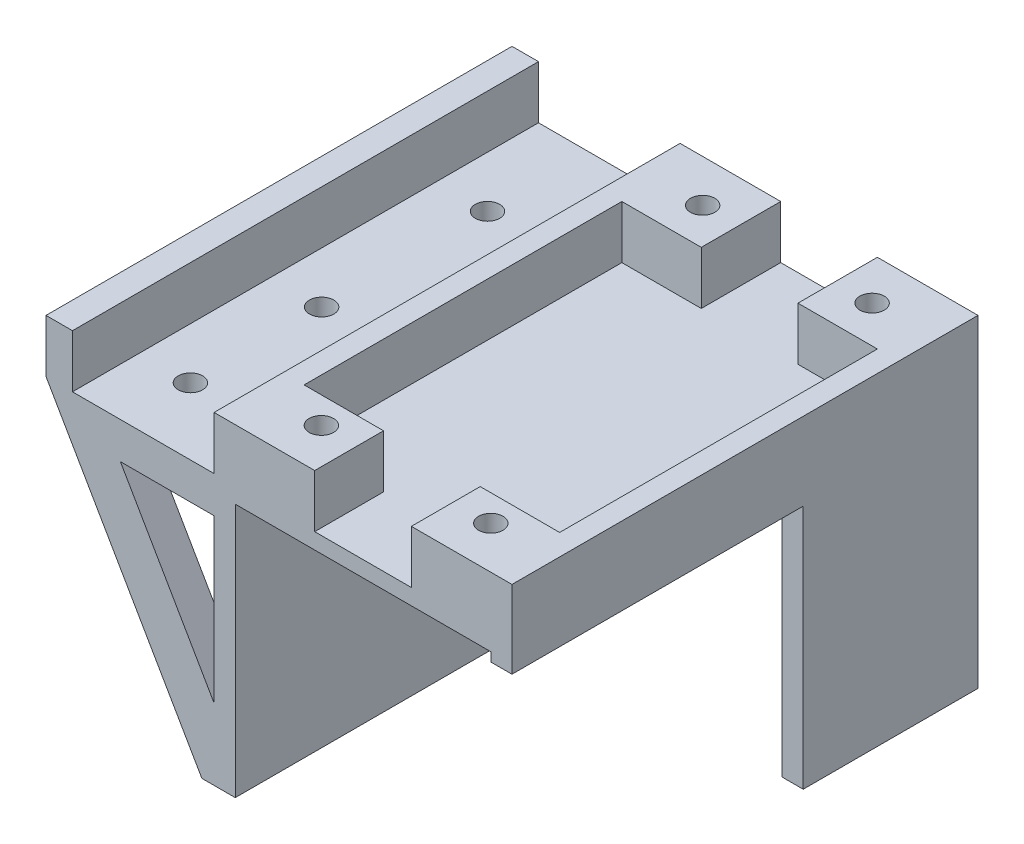
from build123d import *

# Parameters (mm, degrees)
SKETCH1_W            = 48.254
SKETCH1_H            = 10
BOSS_EXTRUDE1_DEPTH  = 70
BOSS_EXTRUDE3_DEPTH  = 8
BOSS_EXTRUDE4_DEPTH  = 8
BOSS_EXTRUDE5_DEPTH  = 8
BOSS_EXTRUDE6_DEPTH  = 70
SKETCH7_W            = 40.394634483
SKETCH7_H            = 17
CUT_EXTRUDE3_DEPTH   = 70
BOSS_EXTRUDE7_DEPTH  = 70
BOSS_EXTRUDE10_DEPTH = 8
BOSS_EXTRUDE11_DEPTH = 70
SKETCH13_W           = 83.001411072
SKETCH13_H           = 87.868559997
CUT_EXTRUDE4_DEPTH   = 4
SKETCH14_W           = 48.254
SKETCH14_H           = 10
BOSS_EXTRUDE12_DEPTH = 20
SKETCH16_W           = 56.254
SKETCH16_H           = 5
CUT_EXTRUDE5_DEPTH   = 100
SKETCH17_W           = 15
SKETCH17_H           = 15
BOSS_EXTRUDE14_DEPTH = 13
CUT_EXTRUDE8_DEPTH   = 5
SKETCH21_R           = 2.3
CUT_EXTRUDE9_DEPTH   = 15
SKETCH23_W           = 12
SKETCH23_H           = 40.530858039
CUT_EXTRUDE10_DEPTH  = 9
SKETCH25_R           = 2.3
CUT_EXTRUDE11_DEPTH  = 20
SKETCH26_R           = 2.3
CUT_EXTRUDE12_DEPTH  = 20
BOSS_EXTRUDE16_DEPTH = 20
SKETCH28_W           = 15
SKETCH28_H           = 15
BOSS_EXTRUDE17_DEPTH = 10
SKETCH29_R           = 2.3
CUT_EXTRUDE13_DEPTH  = 20
SKETCH30_W           = 10.391026801
SKETCH30_H           = 12
BOSS_EXTRUDE18_DEPTH = 5
SKETCH31_R           = 2.3
CUT_EXTRUDE14_DEPTH  = 45
SKETCH36_R           = 60.036471347
CUT_EXTRUDE15_DEPTH  = 2
SKETCH37_W           = 5
SKETCH37_H           = 88
BOSS_EXTRUDE19_DEPTH = 10
CUT_EXTRUDE16_DEPTH  = 5
SKETCH39_R           = 2.1
CUT_EXTRUDE17_DEPTH  = 5
SKETCH40_W           = 55
SKETCH40_H           = 46.30826584
CUT_EXTRUDE18_DEPTH  = 5


with BuildPart() as part:
    # Sketch1 → Boss-Extrude1 (new body)
    with BuildSketch(Plane.XY):
        Polygon((0, 70), (0, 0), (4, 0), (4, 52), (52.254, 52), (52.254, 0), (56.254, 0), (56.254, 70), align=None)
        with Locations((28.127, 60)):
            Rectangle(SKETCH1_W, SKETCH1_H, mode=Mode.SUBTRACT)
    extrude(amount=BOSS_EXTRUDE1_DEPTH)

    # Sketch3 → Boss-Extrude3 (add)
    with BuildSketch(Plane.XY.offset(70)):
        Polygon((0, 62.5), (0, 70), (-40.394634483, 70), (0, 0.034440722), (0, 17.466679003), (-26, 62.5), align=None)
    extrude(amount=-BOSS_EXTRUDE3_DEPTH)

    # Sketch4 → Boss-Extrude4 (add)
    with BuildSketch(Plane(origin=(0, 0, 0), x_dir=(-1, 0, 0), z_dir=(0, 0, -1))):
        Polygon((0, 70), (40.394634483, 70), (0, 0), (0, 17.466679003), (26, 62.5), (0, 62.5), align=None)
    extrude(amount=-BOSS_EXTRUDE4_DEPTH)

    # Sketch5 → Boss-Extrude5 (add)
    with BuildSketch(Plane(origin=(0, 0, 39), x_dir=(-1, 0, 0), z_dir=(0, 0, -1))):
        Polygon((0, 62.5), (0, 70), (40.394634483, 70), (0, 0), (0, 17.466679003), (26, 62.5), align=None)
    extrude(amount=BOSS_EXTRUDE5_DEPTH)

    # Sketch6 → Boss-Extrude6 (add)
    with BuildSketch(Plane(origin=(0, 0, 0), x_dir=(-1, 0, 0), z_dir=(0, 0, -1))):
        Polygon((0, 62.5), (36.066637932, 62.5), (40.394634483, 70), (0, 70), align=None)
        Polygon((-4, 0), (0, 0), (7.50186069, 13), (-4, 13), align=None)
    extrude(amount=-BOSS_EXTRUDE6_DEPTH)

    # Sketch7 → Cut-Extrude3 (cut)
    with BuildSketch(Plane.XY.offset(70)):
        with Locations((-20.197317242, 61.5)):
            Rectangle(SKETCH7_W, SKETCH7_H)
    extrude(amount=-CUT_EXTRUDE3_DEPTH, mode=Mode.SUBTRACT)

    # Sketch8 → Boss-Extrude7 (add)
    with BuildSketch(Plane(origin=(0, 0, 0), x_dir=(-1, 0, 0), z_dir=(0, 0, -1))):
        Polygon((-4, 55), (-4, 52), (30.007442759, 52), (31.73864138, 55), align=None)
    extrude(amount=-BOSS_EXTRUDE7_DEPTH)

    # Sketch11 → Boss-Extrude10 (add)
    with BuildSketch(Plane.XY.offset(70)):
        Polygon((-31.73864138, 55), (0, 0), (-3.053687451, 13), (-27.288965695, 55), align=None)
    extrude(amount=-BOSS_EXTRUDE10_DEPTH)

    # Sketch12 → Boss-Extrude11 (add)
    with BuildSketch(Plane.XY.offset(70)):
        Polygon((-31.73864138, 55), (-27.75981023, 48.105069917), (0, 48.105069917), (0, 55), align=None)
    extrude(amount=-BOSS_EXTRUDE11_DEPTH)

    # Sketch13 → Cut-Extrude4 (cut)
    with BuildSketch(Plane.XZ):
        with Locations((25.938658228, 33.313825886)):
            Rectangle(SKETCH13_W, SKETCH13_H)
    extrude(amount=-CUT_EXTRUDE4_DEPTH, mode=Mode.SUBTRACT)

    # Sketch14 → Boss-Extrude12 (add)
    with BuildSketch(Plane.XY.offset(70)):
        Polygon((-2.308264828, 4), (-31.73864138, 55), (0, 55), (0, 70), (56.254, 70), (56.254, 4), (52.254, 4), (52.254, 52), (4, 52), (4, 4), align=None)
        Polygon((-17.689083241, 48.105069917), (0, 48.105069917), (0, 17.466679003), align=None, mode=Mode.SUBTRACT)
        with Locations((28.127, 60)):
            Rectangle(SKETCH14_W, SKETCH14_H, mode=Mode.SUBTRACT)
    extrude(amount=BOSS_EXTRUDE12_DEPTH)

    # Sketch16 → Cut-Extrude5 (cut)
    with BuildSketch(Plane.XY.offset(90)):
        with Locations((28.127, 67.5)):
            Rectangle(SKETCH16_W, SKETCH16_H)
    extrude(amount=-CUT_EXTRUDE5_DEPTH, mode=Mode.SUBTRACT)

    # Sketch17 → Boss-Extrude14 (add)
    with BuildSketch(Plane(origin=(0, 65, 0), x_dir=(1, 0, 0), z_dir=(0, 1, 0))):
        with Locations((44.754, -7.5)):
            Rectangle(SKETCH17_W, SKETCH17_H)
        with Locations((44.754, -82.5)):
            Rectangle(SKETCH17_W, SKETCH17_H)
    extrude(amount=-BOSS_EXTRUDE14_DEPTH)

    # Sketch22 → Cut-Extrude8 (cut)
    with BuildSketch(Plane.XZ.offset(-52)):
        Polygon((48.096455918, 6.003620146), (47.904143628, 10.329474511), (44.06168771, 12.325854365), (40.411544082, 9.996379854), (40.603856372, 5.670525489), (44.44631229, 3.674145635), align=None)
        Polygon((45.200685086, 75.774625774), (48.386623963, 78.707166221), (47.439938877, 82.932540447), (43.307314914, 84.225374226), (40.121376037, 81.292833779), (41.068061123, 77.067459553), align=None)
    extrude(amount=-CUT_EXTRUDE8_DEPTH, mode=Mode.SUBTRACT)

    # Sketch21 → Cut-Extrude9 (cut)
    with BuildSketch(Plane(origin=(0, 52, 0), x_dir=(-1, 0, 0), z_dir=(0, -1, 0))):
        with Locations((-44.254, -80)):
            Circle(SKETCH21_R)
        with Locations((-44.254, -8)):
            Circle(SKETCH21_R)
    extrude(amount=-CUT_EXTRUDE9_DEPTH, mode=Mode.SUBTRACT)

    # Sketch23 → Cut-Extrude10 (cut)
    with BuildSketch(Plane(origin=(0, 0, 0), x_dir=(0, 0, 1), z_dir=(-0.8661319205837115, -0.49981546209173167, 0))):
        with Locations((76, 35.274689955)):
            Rectangle(SKETCH23_W, SKETCH23_H)
    extrude(amount=-CUT_EXTRUDE10_DEPTH, mode=Mode.SUBTRACT)

    # Sketch25 → Cut-Extrude11 (cut)
    with BuildSketch(Plane(origin=(0, 48.105069917, 0), x_dir=(-1, 0, 0), z_dir=(0, -1, 0))):
        with Locations((17.075514089, -19.30064897)):
            Circle(SKETCH25_R)
        with Locations((17.075514089, -50.613733273)):
            Circle(SKETCH25_R)
    extrude(amount=-CUT_EXTRUDE11_DEPTH, mode=Mode.SUBTRACT)

    # Sketch26 → Cut-Extrude12 (cut)
    with BuildSketch(Plane.XZ.offset(-48.105069917)):
        with Locations((-17.075514089, 75.391336138)):
            Circle(SKETCH26_R)
    extrude(amount=-CUT_EXTRUDE12_DEPTH, mode=Mode.SUBTRACT)

    # Sketch27 → Boss-Extrude16 (add)
    with BuildSketch(Plane.XY.offset(90)):
        Polygon((-23.310381194, 48.105069917), (-27.75981023, 48.105069917), (-31.73864138, 55), (-23.310381194, 55), align=None)
    extrude(amount=-BOSS_EXTRUDE16_DEPTH)

    # Sketch28 → Boss-Extrude17 (add)
    with BuildSketch(Plane(origin=(0, 55, 0), x_dir=(1, 0, 0), z_dir=(0, 1, 0))):
        with Locations((11.5, -7.5)):
            Rectangle(SKETCH28_W, SKETCH28_H)
        with Locations((11.5, -82.5)):
            Rectangle(SKETCH28_W, SKETCH28_H)
    extrude(amount=BOSS_EXTRUDE17_DEPTH)

    # Sketch29 → Cut-Extrude13 (cut)
    with BuildSketch(Plane(origin=(0, 52, 0), x_dir=(-1, 0, 0), z_dir=(0, -1, 0))):
        with Locations((-12.254, -8)):
            Circle(SKETCH29_R)
        with Locations((-12.254, -80)):
            Circle(SKETCH29_R)
    extrude(amount=-CUT_EXTRUDE13_DEPTH, mode=Mode.SUBTRACT)

    # Sketch30 → Boss-Extrude18 (add)
    with BuildSketch(Plane.XZ.offset(-48.105069917)):
        with Locations((-22.56429683, 76)):
            Rectangle(SKETCH30_W, SKETCH30_H)
    extrude(amount=-BOSS_EXTRUDE18_DEPTH)

    # Sketch31 → Cut-Extrude14 (cut)
    with BuildSketch(Plane.XZ.offset(-48.105069917)):
        with Locations((-17.075514089, 75.391336138)):
            Circle(SKETCH31_R)
    extrude(amount=-CUT_EXTRUDE14_DEPTH, mode=Mode.SUBTRACT)

    # Sketch36 → Cut-Extrude15 (cut)
    with BuildSketch(Plane.XY.offset(90)):
        with Locations((23.036116276, 36.93280147)):
            Circle(SKETCH36_R)
    extrude(amount=-CUT_EXTRUDE15_DEPTH, mode=Mode.SUBTRACT)

    # Sketch37 → Boss-Extrude19 (add)
    with BuildSketch(Plane(origin=(0, 55, 0), x_dir=(1, 0, 0), z_dir=(0, 1, 0))):
        with Locations((-29.23864138, -44)):
            Rectangle(SKETCH37_W, SKETCH37_H)
    extrude(amount=BOSS_EXTRUDE19_DEPTH)

    # Sketch38 → Cut-Extrude16 (cut)
    with BuildSketch(Plane.XZ.offset(-52)):
        Polygon((12.254, 75.669872981), (16.004, 77.834936491), (16.004, 82.165063509), (12.254, 84.330127019), (8.504, 82.165063509), (8.504, 77.834936491), align=None)
        Polygon((15.567298341, 5.212159598), (16.32498978, 9.475480332), (13.011691439, 12.263320734), (8.940701659, 10.787840402), (8.18301022, 6.524519668), (11.496308561, 3.736679266), align=None)
    extrude(amount=-CUT_EXTRUDE16_DEPTH, mode=Mode.SUBTRACT)

    # Sketch39 → Cut-Extrude17 (cut)
    with BuildSketch(Plane(origin=(4, 0, 0), x_dir=(0, 0, -1), z_dir=(1, 0, 0))):
        with Locations((-47.514718626, 36.485281374)):
            Circle(SKETCH39_R)
        with Locations((-48, 20)):
            Circle(SKETCH39_R)
        with Locations((-16.485281374, 19.514718626)):
            Circle(SKETCH39_R)
        with Locations((-16.485281374, 36.485281374)):
            Circle(SKETCH39_R)
    extrude(amount=-CUT_EXTRUDE17_DEPTH, mode=Mode.SUBTRACT)

    # Sketch40 → Cut-Extrude18 (cut)
    with BuildSketch(Plane(origin=(56.254, 0, 0), x_dir=(0, 0, -1), z_dir=(1, 0, 0))):
        with Locations((-60.5, 27.15413292)):
            Rectangle(SKETCH40_W, SKETCH40_H)
    extrude(amount=-CUT_EXTRUDE18_DEPTH, mode=Mode.SUBTRACT)


solid = part.part
